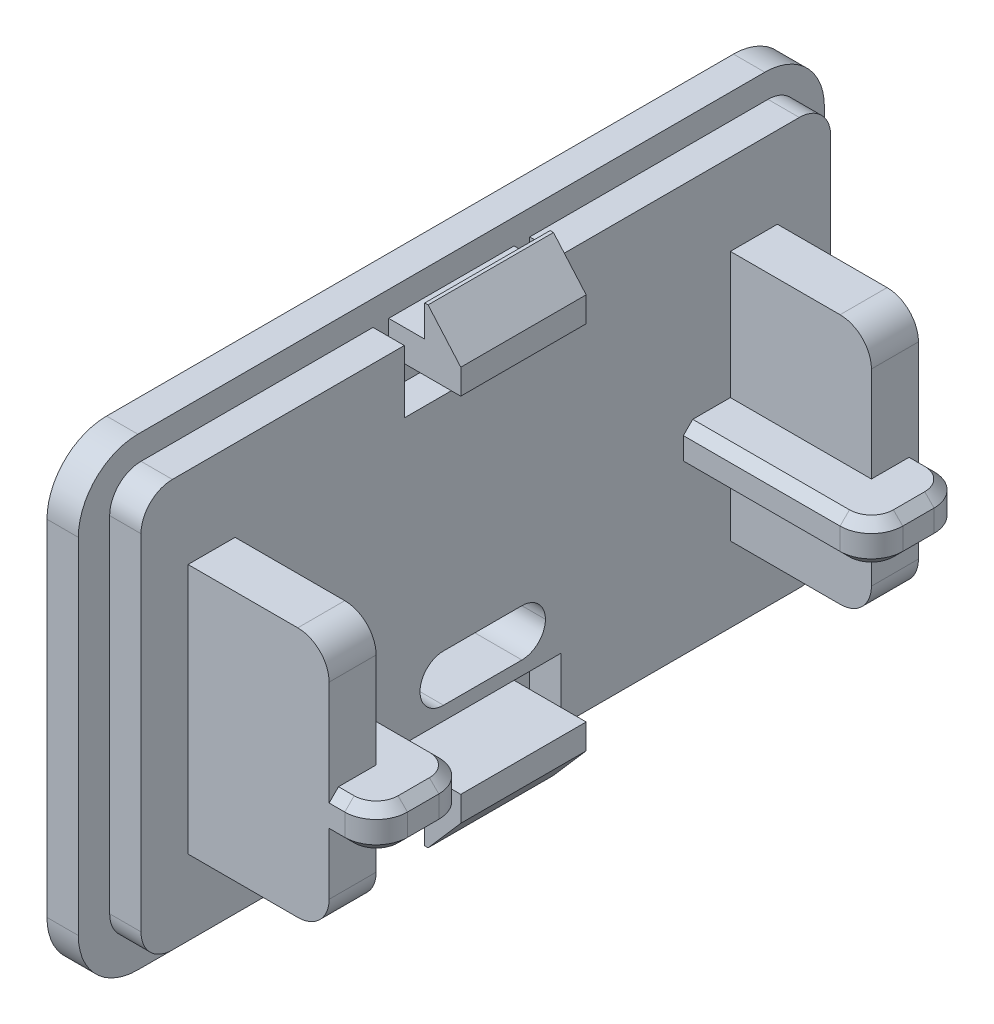
from build123d import *
from OCP.BRepFilletAPI import BRepFilletAPI_MakeChamfer

# Parameters (mm, degrees)
EXTRUDE_1_DEPTH     = 1
EXTRUDE_2_DEPTH     = 1
SKETCH_3_W          = 1.5
SKETCH_3_H          = 8
EXTRUDE_3_DEPTH     = 4.5
SKETCH_4_W          = 3
SKETCH_4_H          = 1.3
EXTRUDE_4_DEPTH     = 6
FILLET_1_R          = 1
CHAMFER_1_SIZE      = 0.3
SKETCH_5_W          = 5
SKETCH_5_H          = 2
CUT_EXTRUDE_1_DEPTH = 1
SKETCH_6_W          = 4
SKETCH_6_H          = 1
EXTRUDE_5_DEPTH     = 2.3
SKETCH_7_W          = 1.15
SKETCH_7_H          = 4
EXTRUDE_6_DEPTH     = 1
CUT_EXTRUDE_2_REACH = 20.465
SKETCH_10_W         = 4
SKETCH_10_H         = 1.5
FILLET_2_R          = 0.75
SKETCH_11_W         = 1.15
SKETCH_11_H         = 4
EXTRUDE_7_DEPTH     = 1
CHAMFER_2_SIZE      = 1.2
CHAMFER_2_SIZE2     = 1.043144085


with BuildPart() as part:
    # 草图1 → 凸台-拉伸1 (new body)
    with BuildSketch(Plane(origin=(0, 0, 0), x_dir=(0, 0, -1), z_dir=(1, 0, 0))):
        with BuildLine():
            Line((-8.62016793, -6.710374314), (-8.62016793, 4.289625686))
            ThreePointArc((-8.62016793, 4.289625686), (-8.327274711, 4.996732467), (-7.62016793, 5.289625686))
            Line((-7.62016793, 5.289625686), (12.37983207, 5.289625686))
            ThreePointArc((12.37983207, 5.289625686), (13.086938851, 4.996732467), (13.37983207, 4.289625686))
            Line((13.37983207, 4.289625686), (13.37983207, -6.710374314))
            ThreePointArc((13.37983207, -6.710374314), (13.086938851, -7.417481096), (12.37983207, -7.710374314))
            Line((12.37983207, -7.710374314), (-7.62016793, -7.710374314))
            ThreePointArc((-7.62016793, -7.710374314), (-8.327274711, -7.417481096), (-8.62016793, -6.710374314))
        make_face()
    extrude(amount=EXTRUDE_1_DEPTH)

    # 草图2 → 凸台-拉伸2 (add)
    with BuildSketch(Plane.ZY):
        with BuildLine():
            Line((9.62016793, -6.810374314), (9.62016793, 4.189625686))
            ThreePointArc((9.62016793, 4.189625686), (9.063670815, 5.53312857), (7.72016793, 6.089625686))
            Line((7.72016793, 6.089625686), (-12.27983207, 6.089625686))
            ThreePointArc((-12.27983207, 6.089625686), (-13.623334954, 5.53312857), (-14.17983207, 4.189625686))
            Line((-14.17983207, 4.189625686), (-14.17983207, -6.810374314))
            ThreePointArc((-14.17983207, -6.810374314), (-13.623334954, -8.153877199), (-12.27983207, -8.710374314))
            Line((-12.27983207, -8.710374314), (7.72016793, -8.710374314))
            ThreePointArc((7.72016793, -8.710374314), (9.063670815, -8.153877199), (9.62016793, -6.810374314))
        make_face()
    extrude(amount=EXTRUDE_2_DEPTH)

    # 草图3 → 凸台-拉伸3 (add)
    with BuildSketch(Plane(origin=(1, 0, 0), x_dir=(0, 0, -1), z_dir=(1, 0, 0))):
        with Locations((-6.37016793, -1.310374314)):
            Rectangle(SKETCH_3_W, SKETCH_3_H)
        with Locations((10.92983207, -1.310374314)):
            Rectangle(SKETCH_3_W, SKETCH_3_H)
    extrude(amount=EXTRUDE_3_DEPTH)

    # 草图4 → 凸台-拉伸4 (add)
    with BuildSketch(Plane(origin=(1, 0, 0), x_dir=(0, 0, -1), z_dir=(1, 0, 0))):
        with Locations((-5.62016793, -1.999635097)):
            Rectangle(SKETCH_4_W, SKETCH_4_H)
        with Locations((10.17983207, -1.999635097)):
            Rectangle(SKETCH_4_W, SKETCH_4_H)
    extrude(amount=EXTRUDE_4_DEPTH)

    # 圆角1
    fillet_1_edges = [part.edges().sort_by_distance(p)[0] for p in [
        (7, -1.999635097, -8.67983207),
        (7, -1.999635097, -11.67983207),
        (5.5, -5.310374314, 6.37016793),
        (5.5, 2.689625686, 6.37016793),
        (5.5, -5.310374314, -10.92983207),
        (5.5, 2.689625686, -10.92983207),
        (7, -1.999635097, 7.12016793),
        (7, -1.999635097, 4.12016793),
    ]]
    fillet(fillet_1_edges, radius=FILLET_1_R)

    # 倒角1
    chamfer_1_edges = [part.edges().sort_by_distance(p)[0] for p in [
        (5.75, -2.649635097, 7.12016793),
        (5.75, -1.349635097, 7.12016793),
        (5.75, -1.349635097, -11.67983207),
        (5.75, -2.649635097, -11.67983207),
        (7, -2.649635097, -10.17983207),
        (7, -1.349635097, -10.17983207),
        (3.5, -2.649635097, -8.67983207),
        (6.707106781, -2.649635097, -11.386938851),
        (6.707106781, -2.649635097, -8.972725289),
        (3.5, -1.349635097, -8.67983207),
        (6.707106781, -1.349635097, -11.386938851),
        (6.707106781, -1.349635097, -8.972725289),
        (7, -2.649635097, 5.62016793),
        (7, -1.349635097, 5.62016793),
        (3.5, -2.649635097, 4.12016793),
        (6.707106781, -2.649635097, 4.413061149),
        (6.707106781, -2.649635097, 6.827274711),
        (3.5, -1.349635097, 4.12016793),
        (6.707106781, -1.349635097, 4.413061149),
        (6.707106781, -1.349635097, 6.827274711),
    ]]
    chamfer(chamfer_1_edges, length=CHAMFER_1_SIZE)

    # 草图5 → 切除-拉伸1 (cut)
    with BuildSketch(Plane(origin=(1, 0, 0), x_dir=(0, 0, -1), z_dir=(1, 0, 0))):
        with Locations((2.27983207, -6.710374314)):
            Rectangle(SKETCH_5_W, SKETCH_5_H)
        with Locations((2.27983207, 4.289625686)):
            Rectangle(SKETCH_5_W, SKETCH_5_H)
    extrude(amount=-CUT_EXTRUDE_1_DEPTH, mode=Mode.SUBTRACT)

    # 草图6 → 凸台-拉伸5 (add)
    with BuildSketch(Plane(origin=(0, 0, 0), x_dir=(0, 0, -1), z_dir=(1, 0, 0))):
        with Locations((2.27983207, -7.210374314)):
            Rectangle(SKETCH_6_W, SKETCH_6_H)
        with Locations((2.27983207, 4.789625686)):
            Rectangle(SKETCH_6_W, SKETCH_6_H)
    extrude(amount=EXTRUDE_5_DEPTH)

    # 草图7 → 凸台-拉伸6 (add)
    with BuildSketch(Plane.XZ.offset(7.710374314)):
        with Locations((1.725, -2.27983207)):
            Rectangle(SKETCH_7_W, SKETCH_7_H)
    extrude(amount=EXTRUDE_6_DEPTH)

    # 草图10 → 切除-拉伸2 (cut, up to next)
    with BuildSketch(Plane.ZY.offset(1), mode=Mode.PRIVATE) as cut_extrude_2_sk1:
        with Locations((-2.27983207, -4.523813103)):
            Rectangle(SKETCH_10_W, SKETCH_10_H)
    cut_extrude_2_tool1 = extrude(cut_extrude_2_sk1.sketch, amount=-CUT_EXTRUDE_2_REACH, mode=Mode.PRIVATE) & part.part
    add(cut_extrude_2_tool1.solids().sort_by_distance((-1, -4.523813, -2.279832))[0], mode=Mode.SUBTRACT)

    # 圆角2
    fillet_2_edges = [part.edges().sort_by_distance(p)[0] for p in [
        (0, -5.273813103, -0.27983207),
        (0, -3.773813103, -0.27983207),
        (0, -3.773813103, -4.27983207),
        (0, -5.273813103, -4.27983207),
    ]]
    fillet(fillet_2_edges, radius=FILLET_2_R - 0.0001)  # a hair under: the kernel refuses the full size

    # 草图11 → 凸台-拉伸7 (add)
    with BuildSketch(Plane(origin=(0, 5.289625686, 0), x_dir=(1, 0, 0), z_dir=(0, 1, 0))):
        with Locations((1.725, 2.27983207)):
            Rectangle(SKETCH_11_W, SKETCH_11_H)
    extrude(amount=EXTRUDE_7_DEPTH)

    # 倒角2: one chamfer whose edges measure the first distance from different faces: ONE call of the kernel's chamfer builder (chamfer() names one face for all edges)
    chamfer_2_edges_1 = [part.edges().sort_by_distance(p)[0] for p in [
        (2.3, -8.710374314, -2.27983207),
    ]]
    chamfer_2_side_1 = [part.faces().sort_by_distance(p)[0] for p in [
        (2.3, -7.710374314, -2.27983207),
    ]]
    chamfer_2_edges_2 = [part.edges().sort_by_distance(p)[0] for p in [
        (2.3, 6.289625686, -2.27983207),
    ]]
    chamfer_2_side_2 = [part.faces().sort_by_distance(p)[0] for p in [
        (2.3, 5.289625686, -2.27983207),
    ]]
    chamfer_2 = BRepFilletAPI_MakeChamfer(part.part.solid().wrapped)
    for e in chamfer_2_edges_1:
        chamfer_2.Add(CHAMFER_2_SIZE, CHAMFER_2_SIZE2, e.wrapped, chamfer_2_side_1[0].wrapped)  # the first distance lies on this face
    for e in chamfer_2_edges_2:
        chamfer_2.Add(CHAMFER_2_SIZE, CHAMFER_2_SIZE2, e.wrapped, chamfer_2_side_2[0].wrapped)  # the first distance lies on this face
    add(Compound.cast(chamfer_2.Shape()), mode=Mode.REPLACE)


solid = part.part
